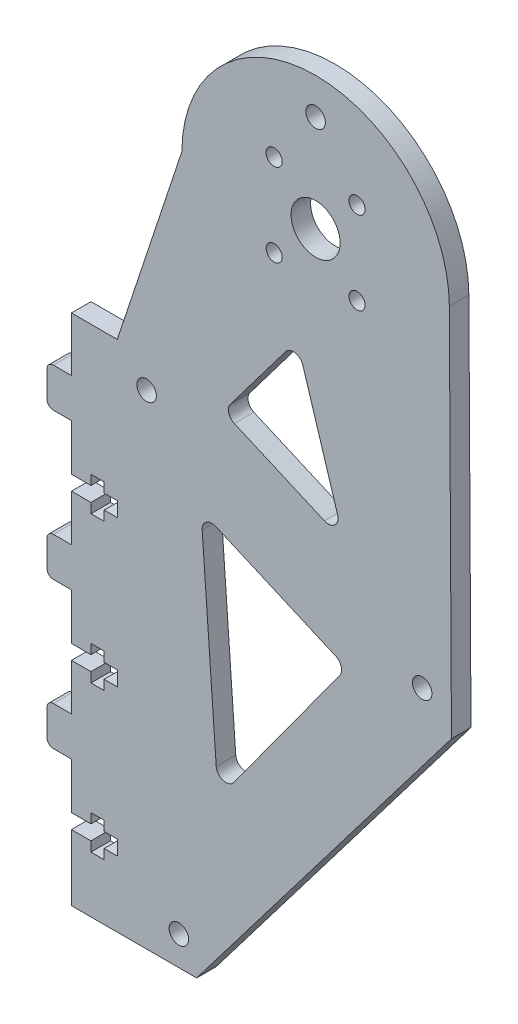
from build123d import *

# Parameters (mm, degrees)
SKETCH_1_R      = 5.0225
SKETCH_1_R_2    = 2
SKETCH_1_R_3    = 1.65
EXTRUDE_1_DEPTH = 4
FILLET_1_R      = 2
FILLET_2_R      = 1.3


with BuildPart() as part:
    # 草图1 → 凸台-拉伸1 (new body)
    with BuildSketch(Plane.XY):
        with BuildLine():
            Line((298.551498293, -96.645689396), (302.551498293, -96.645689396))
            Line((302.551498293, -96.645689396), (302.551498293, -98.644151028))
            Line((302.551498293, -98.644151028), (305.251498293, -98.644151028))
            Line((305.251498293, -98.644151028), (305.251498293, -96.645689396))
            Line((305.251498293, -96.645689396), (307.951498293, -96.645689396))
            Line((307.951498293, -96.645689396), (307.951498293, -93.645689396))
            Line((307.951498293, -93.645689396), (305.251498293, -93.645689396))
            Line((305.251498293, -93.645689396), (305.251498293, -91.647227763))
            Line((305.251498293, -91.647227763), (302.551498293, -91.647227763))
            Line((302.551498293, -91.647227763), (302.551498293, -93.645689396))
            Line((302.551498293, -93.645689396), (298.551498293, -93.645689396))
            Line((298.551498293, -93.645689396), (298.551498293, -84.145716775))
            Line((298.551498293, -84.145716775), (293.551498293, -84.145716775))
            Line((293.551498293, -84.145716775), (293.551498293, -76.145716775))
            Line((293.551498293, -76.145716775), (298.551498293, -76.145716775))
            Line((298.551498293, -76.145716775), (298.551498293, -66.645694374))
            Line((298.551498293, -66.645694374), (302.551498293, -66.645694374))
            Line((302.551498293, -66.645694374), (302.551498293, -68.644156006))
            Line((302.551498293, -68.644156006), (305.251498293, -68.644156006))
            Line((305.251498293, -68.644156006), (305.251498293, -66.645694374))
            Line((305.251498293, -66.645694374), (307.951498293, -66.645694374))
            Line((307.951498293, -66.645694374), (307.951498293, -63.645694374))
            Line((307.951498293, -63.645694374), (305.251498293, -63.645694374))
            Line((305.251498293, -63.645694374), (305.251498293, -61.647232741))
            Line((305.251498293, -61.647232741), (302.551498293, -61.647232741))
            Line((302.551498293, -61.647232741), (302.551498293, -63.645694374))
            Line((302.551498293, -63.645694374), (298.551498293, -63.645694374))
            Line((298.551498293, -63.645694374), (298.551498293, -54.145671973))
            Line((298.551498293, -54.145671973), (293.551498293, -54.145671973))
            Line((293.551498293, -54.145671973), (293.551498293, -46.145671973))
            Line((293.551498293, -46.145671973), (298.551498293, -46.145671973))
            Line((298.551498293, -46.145671973), (298.551498293, -35.045714286))
            Line((298.551498293, -35.045714286), (307.942857143, -35.045714286))
            Line((307.942857143, -35.045714286), (321.159325739, 4.854285714))
            ThreePointArc((321.159325739, 4.854285714), (348.542857143, 32.081451417), (375.926388547, 4.854285714))
            Line((375.926388547, 4.854285714), (376.364473934, -71.645714286))
            Line((376.364473934, -71.645714286), (324.194731876, -140.145734198))
            Line((324.194731876, -140.145734198), (298.551498293, -140.145734198))
            Line((298.551498293, -140.145734198), (298.551498293, -126.645734198))
            Line((298.551498293, -126.645734198), (302.551498293, -126.645734198))
            Line((302.551498293, -126.645734198), (302.551498293, -128.644195831))
            Line((302.551498293, -128.644195831), (305.251498293, -128.644195831))
            Line((305.251498293, -128.644195831), (305.251498293, -126.645734198))
            Line((305.251498293, -126.645734198), (307.951498293, -126.645734198))
            Line((307.951498293, -126.645734198), (307.951498293, -123.645734198))
            Line((307.951498293, -123.645734198), (305.251498293, -123.645734198))
            Line((305.251498293, -123.645734198), (305.251498293, -121.647272565))
            Line((305.251498293, -121.647272565), (302.551498293, -121.647272565))
            Line((302.551498293, -121.647272565), (302.551498293, -123.645734198))
            Line((302.551498293, -123.645734198), (298.551498293, -123.645734198))
            Line((298.551498293, -123.645734198), (298.551498293, -114.145711797))
            Line((298.551498293, -114.145711797), (293.551498293, -114.145711797))
            Line((293.551498293, -114.145711797), (293.551498293, -106.145711797))
            Line((293.551498293, -106.145711797), (298.551498293, -106.145711797))
            Line((298.551498293, -106.145711797), (298.551498293, -96.645689396))
        make_face()
        with Locations((348.542857143, 4.854285714)):
            Circle(SKETCH_1_R, mode=Mode.SUBTRACT)
        with Locations((348.542857143, 24.697471009)):
            Circle(SKETCH_1_R_2, mode=Mode.SUBTRACT)
        with Locations((320.551498293, -134.145734198)):
            Circle(SKETCH_1_R_2, mode=Mode.SUBTRACT)
        with Locations((370.364473934, -65.645714286)):
            Circle(SKETCH_1_R_2, mode=Mode.SUBTRACT)
        with Locations((313.942857143, -41.045714286)):
            Circle(SKETCH_1_R_2, mode=Mode.SUBTRACT)
        with Locations((340.057575769, 13.339567089)):
            Circle(SKETCH_1_R_3, mode=Mode.SUBTRACT)
        with Locations((357.028138517, 13.339567089)):
            Circle(SKETCH_1_R_3, mode=Mode.SUBTRACT)
        with Locations((357.028138517, -3.63099566)):
            Circle(SKETCH_1_R_3, mode=Mode.SUBTRACT)
        with Locations((340.057575769, -3.63099566)):
            Circle(SKETCH_1_R_3, mode=Mode.SUBTRACT)
        Polygon((354.95315454, -69.835495731), (328.585486884, -106.094838527), (325.087312939, -56.813896117), align=None, mode=Mode.SUBTRACT)
        Polygon((329.57699596, -36.9530828), (354.34318526, -47.751218186), (344.764617274, -16.87417598), align=None, mode=Mode.SUBTRACT)
    extrude(amount=EXTRUDE_1_DEPTH)

    # 圆角1
    fillet_1_edges = [part.edges().sort_by_distance(p)[0] for p in [
        (344.764617274, -16.87417598, 2),
        (329.57699596, -36.9530828, 2),
        (354.34318526, -47.751218186, 2),
        (325.087312939, -56.813896117, 2),
        (328.585486884, -106.094838527, 2),
        (354.95315454, -69.835495731, 2),
    ]]
    fillet(fillet_1_edges, radius=FILLET_1_R)

    # 圆角2
    fillet_2_edges = [part.edges().sort_by_distance(p)[0] for p in [
        (293.551498293, -46.145671973, 2),
        (293.551498293, -54.145671973, 2),
        (293.551498293, -84.145716775, 2),
        (293.551498293, -76.145716775, 2),
        (293.551498293, -114.145711797, 2),
        (293.551498293, -106.145711797, 2),
    ]]
    fillet(fillet_2_edges, radius=FILLET_2_R)


solid = part.part
